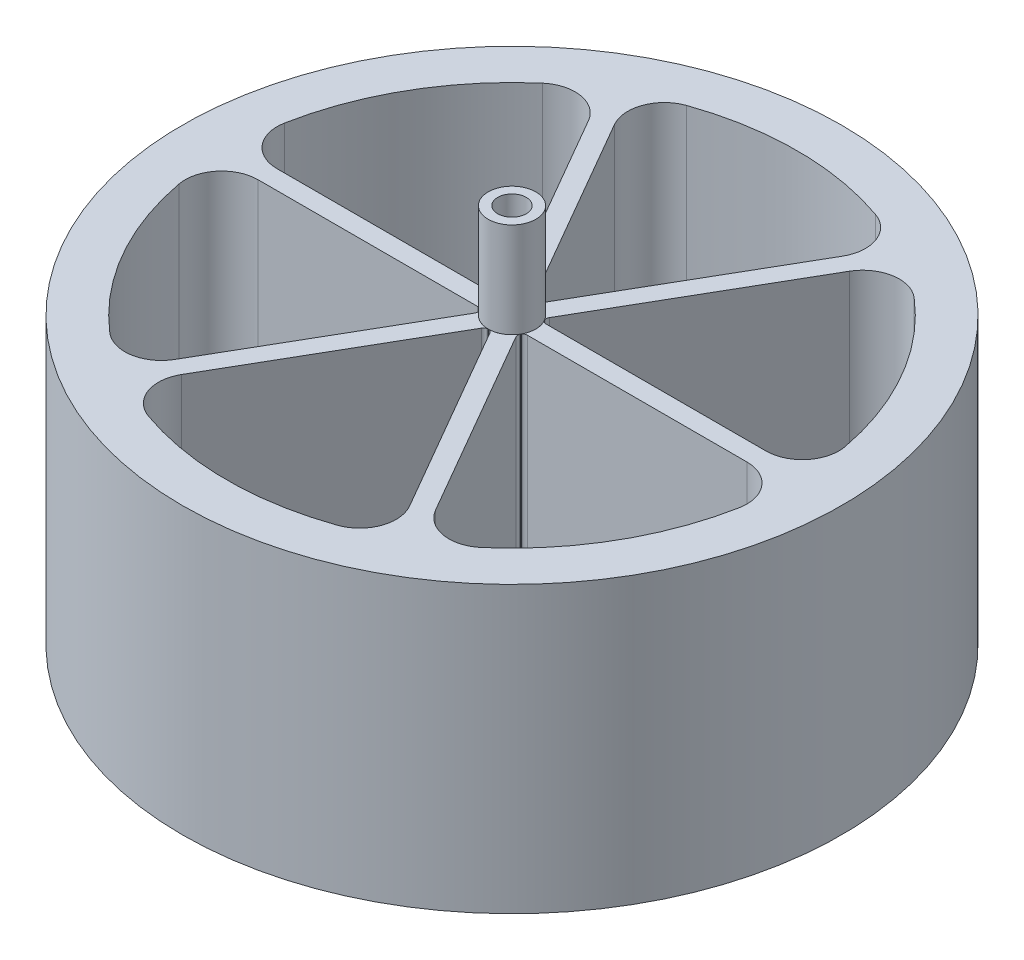
from build123d import *

# Parameters (mm, degrees)
SKETCH1_R             = 2.5
SKETCH1_R_2           = 1.5
BOSS_EXTRUDE1_DEPTH   = 10
BOSS_EXTRUDE3_DEPTH   = 30
BOSS_EXTRUDE3_2_DEPTH = 30
BOSS_EXTRUDE3_3_DEPTH = 30
BOSS_EXTRUDE3_4_DEPTH = 30
BOSS_EXTRUDE3_5_DEPTH = 30
BOSS_EXTRUDE3_6_DEPTH = 30
SKETCH5_R             = 34.666608733
SKETCH5_R_2           = 30
BOSS_EXTRUDE4_DEPTH   = 30
BOSS_EXTRUDE5_START   = -10
SKETCH6_R             = 1.5
BOSS_EXTRUDE5_DEPTH   = 10
SKETCH7_R             = 1.5
CUT_EXTRUDE1_DEPTH    = 9


with BuildPart() as part:
    # Sketch1 → Boss-Extrude1 (new body)
    with BuildSketch(Plane(origin=(0, 0, 0), x_dir=(1, 0, 0), z_dir=(0, 1, 0))):
        Circle(SKETCH1_R)
        Circle(SKETCH1_R_2, mode=Mode.SUBTRACT)
    extrude(amount=BOSS_EXTRUDE1_DEPTH)

    # Sketch6 → Boss-Extrude5 (add)
    with BuildSketch(Plane(origin=(0, 10, 0), x_dir=(1, 0, 0), z_dir=(0, 1, 0)).offset(BOSS_EXTRUDE5_START)):
        Circle(SKETCH6_R)
    extrude(amount=BOSS_EXTRUDE5_DEPTH)

    # Sketch7 → Cut-Extrude1 (cut)
    with BuildSketch(Plane(origin=(0, 10, 0), x_dir=(1, 0, 0), z_dir=(0, 1, 0))):
        Circle(SKETCH7_R)
    extrude(amount=-CUT_EXTRUDE1_DEPTH, mode=Mode.SUBTRACT)


with BuildPart() as body_2:
    # Sketch2 → Boss-Extrude3 (new body)
    with BuildSketch(Plane(origin=(0, 0, 0), x_dir=(-1, 0, 0), z_dir=(0, -1, 0))):
        with BuildLine():
            Line((2.61395079, 1), (25.707973339, 1))
            ThreePointArc((25.707973339, 1), (28.664062792, 2.388870469), (29.481986287, 5.550899437))
            ThreePointArc((29.481986287, 5.550899437), (30, 0), (29.481986287, -5.550899437))
            ThreePointArc((29.481986287, -5.550899437), (28.664062792, -2.388870469), (25.707973339, -1))
            Line((25.707973339, -1), (2.61395079, -1))
            ThreePointArc((2.61395079, -1), (2.399550586, -1.045528996), (2.222154945, -1.174257873))
            Line((2.222154945, -1.174257873), (2.178514499, -1.226407182))
            ThreePointArc((2.178514499, -1.226407182), (2.499969191, -0.012411485), (2.190584188, 1.204716114))
            Line((2.190584188, 1.204716114), (2.222154945, 1.174257873))
            ThreePointArc((2.222154945, 1.174257873), (2.399550586, 1.045528996), (2.61395079, 1))
        make_face()
    extrude(amount=BOSS_EXTRUDE3_DEPTH)



with BuildPart() as body_3:
    # Sketch2 → Boss-Extrude3 2 (new body)
    with BuildSketch(Plane(origin=(0, 0, 0), x_dir=(-1, 0, 0), z_dir=(0, -1, 0))):
        with BuildLine():
            Line((0.440949991, -2.763747789), (11.987961266, -22.763757991))
            ThreePointArc((11.987961266, -22.763757991), (12.263208883, -26.018241788), (9.933773217, -28.307598797))
            ThreePointArc((9.933773217, -28.307598797), (15, -25.980762114), (19.54821307, -22.75669936))
            ThreePointArc((19.54821307, -22.75669936), (16.400853909, -23.629371319), (13.720012073, -21.763757991))
            Line((13.720012073, -21.763757991), (2.173000799, -1.763747789))
            ThreePointArc((2.173000799, -1.763747789), (2.105229964, -1.555307267), (2.128014621, -1.337313697))
            Line((2.128014621, -1.337313697), (2.138606853, -1.294743499))
            ThreePointArc((2.138606853, -1.294743499), (1.239235934, -2.17124257), (0.027157474, -2.49985249))
            Line((0.027157474, -2.49985249), (0.094140324, -2.511571571))
            ThreePointArc((0.094140324, -2.511571571), (0.294320622, -2.600836263), (0.440949991, -2.763747789))
        make_face()
    extrude(amount=BOSS_EXTRUDE3_2_DEPTH)


with BuildPart() as body_4:
    # Sketch2 → Boss-Extrude3 3 (new body)
    with BuildSketch(Plane(origin=(0, 0, 0), x_dir=(-1, 0, 0), z_dir=(0, -1, 0))):
        with BuildLine():
            Line((-2.173000799, -1.763747789), (-13.720012073, -21.763757991))
            ThreePointArc((-13.720012073, -21.763757991), (-16.400853909, -23.629371319), (-19.54821307, -22.75669936))
            ThreePointArc((-19.54821307, -22.75669936), (-15, -25.980762114), (-9.933773217, -28.307598797))
            ThreePointArc((-9.933773217, -28.307598797), (-12.263208883, -26.018241788), (-11.987961266, -22.763757991))
            Line((-11.987961266, -22.763757991), (-0.440949991, -2.763747789))
            ThreePointArc((-0.440949991, -2.763747789), (-0.294320622, -2.600836263), (-0.094140324, -2.511571571))
            Line((-0.094140324, -2.511571571), (-0.051977335, -2.499459613))
            ThreePointArc((-0.051977335, -2.499459613), (-1.260733257, -2.158831086), (-2.151357025, -1.273445308))
            Line((-2.151357025, -1.273445308), (-2.128014621, -1.337313697))
            ThreePointArc((-2.128014621, -1.337313697), (-2.105229964, -1.555307267), (-2.173000799, -1.763747789))
        make_face()
    extrude(amount=BOSS_EXTRUDE3_3_DEPTH)


with BuildPart() as body_5:
    # Sketch2 → Boss-Extrude3 4 (new body)
    with BuildSketch(Plane(origin=(0, 0, 0), x_dir=(-1, 0, 0), z_dir=(0, -1, 0))):
        with BuildLine():
            Line((-2.61395079, 1), (-25.707973339, 1))
            ThreePointArc((-25.707973339, 1), (-28.664062792, 2.388870469), (-29.481986287, 5.550899437))
            ThreePointArc((-29.481986287, 5.550899437), (-30, 0), (-29.481986287, -5.550899437))
            ThreePointArc((-29.481986287, -5.550899437), (-28.664062792, -2.388870469), (-25.707973339, -1))
            Line((-25.707973339, -1), (-2.61395079, -1))
            ThreePointArc((-2.61395079, -1), (-2.399550586, -1.045528996), (-2.222154945, -1.174257873))
            Line((-2.222154945, -1.174257873), (-2.190584188, -1.204716114))
            ThreePointArc((-2.190584188, -1.204716114), (-2.499969191, 0.012411485), (-2.178514499, 1.226407182))
            Line((-2.178514499, 1.226407182), (-2.222154945, 1.174257873))
            ThreePointArc((-2.222154945, 1.174257873), (-2.399550586, 1.045528996), (-2.61395079, 1))
        make_face()
    extrude(amount=BOSS_EXTRUDE3_4_DEPTH)


with BuildPart() as body_6:
    # Sketch2 → Boss-Extrude3 5 (new body)
    with BuildSketch(Plane(origin=(0, 0, 0), x_dir=(-1, 0, 0), z_dir=(0, -1, 0))):
        with BuildLine():
            Line((-0.440949991, 2.763747789), (-11.987961266, 22.763757991))
            ThreePointArc((-11.987961266, 22.763757991), (-12.263208883, 26.018241788), (-9.933773217, 28.307598797))
            ThreePointArc((-9.933773217, 28.307598797), (-15, 25.980762114), (-19.54821307, 22.75669936))
            ThreePointArc((-19.54821307, 22.75669936), (-16.400853909, 23.629371319), (-13.720012073, 21.763757991))
            Line((-13.720012073, 21.763757991), (-2.173000799, 1.763747789))
            ThreePointArc((-2.173000799, 1.763747789), (-2.105229964, 1.555307267), (-2.128014621, 1.337313697))
            Line((-2.128014621, 1.337313697), (-2.138606853, 1.294743499))
            ThreePointArc((-2.138606853, 1.294743499), (-1.239235934, 2.17124257), (-0.027157474, 2.49985249))
            Line((-0.027157474, 2.49985249), (-0.094140324, 2.511571571))
            ThreePointArc((-0.094140324, 2.511571571), (-0.294320622, 2.600836263), (-0.440949991, 2.763747789))
        make_face()
    extrude(amount=BOSS_EXTRUDE3_5_DEPTH)


with BuildPart() as body_7:
    # Sketch2 → Boss-Extrude3 6 (new body)
    with BuildSketch(Plane(origin=(0, 0, 0), x_dir=(-1, 0, 0), z_dir=(0, -1, 0))):
        with BuildLine():
            Line((2.173000799, 1.763747789), (13.720012073, 21.763757991))
            ThreePointArc((13.720012073, 21.763757991), (16.400853909, 23.629371319), (19.54821307, 22.75669936))
            ThreePointArc((19.54821307, 22.75669936), (15, 25.980762114), (9.933773217, 28.307598797))
            ThreePointArc((9.933773217, 28.307598797), (12.263208883, 26.018241788), (11.987961266, 22.763757991))
            Line((11.987961266, 22.763757991), (0.440949991, 2.763747789))
            ThreePointArc((0.440949991, 2.763747789), (0.294320622, 2.600836263), (0.094140324, 2.511571571))
            Line((0.094140324, 2.511571571), (0.051977335, 2.499459613))
            ThreePointArc((0.051977335, 2.499459613), (1.260733257, 2.158831086), (2.151357025, 1.273445308))
            Line((2.151357025, 1.273445308), (2.128014621, 1.337313697))
            ThreePointArc((2.128014621, 1.337313697), (2.105229964, 1.555307267), (2.173000799, 1.763747789))
        make_face()
    extrude(amount=BOSS_EXTRUDE3_6_DEPTH)


with BuildPart() as body_2_1:
    add(body_2.part)

    add(body_3.part)  # Boss-Extrude4 merges body 3

    add(body_4.part)  # Boss-Extrude4 merges body 4

    add(body_5.part)  # Boss-Extrude4 merges body 5

    add(body_6.part)  # Boss-Extrude4 merges body 6

    add(body_7.part)  # Boss-Extrude4 merges body 7
    # Sketch5 → Boss-Extrude4 (add)
    with BuildSketch(Plane(origin=(0, -30, 0), x_dir=(-1, 0, 0), z_dir=(0, -1, 0))):
        Circle(SKETCH5_R)
        Circle(SKETCH5_R_2, mode=Mode.SUBTRACT)
    extrude(amount=-BOSS_EXTRUDE4_DEPTH)


solid = Compound([part.part, body_2_1.part])
